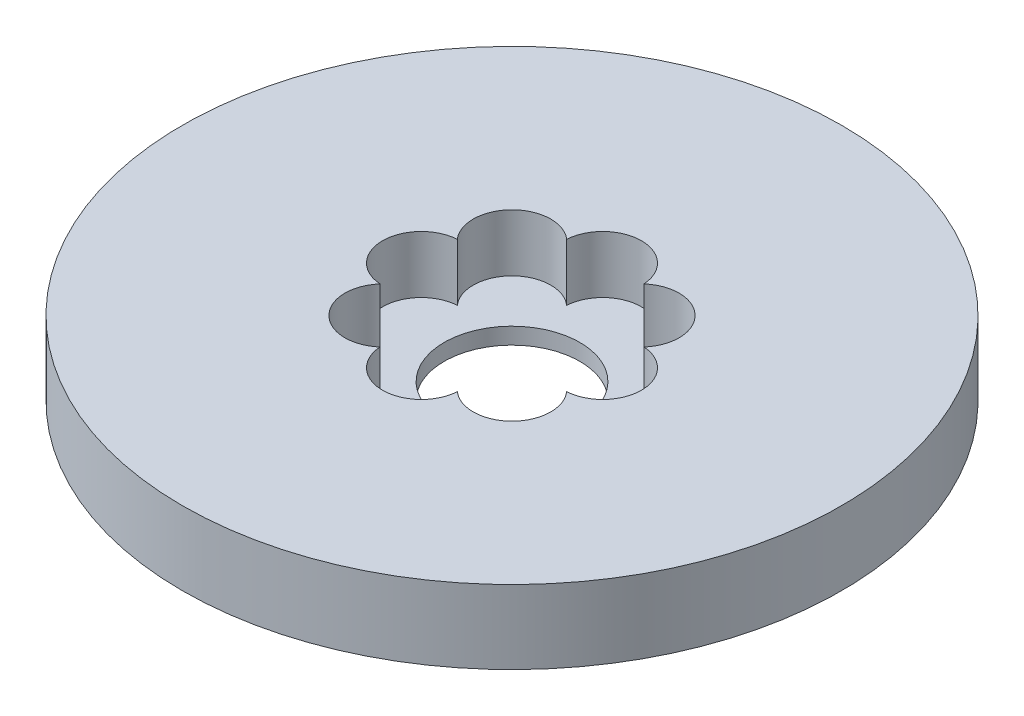
from build123d import *

# Parameters (mm, degrees)
SKETCH1_R           = 85
BOSS_EXTRUDE1_DEPTH = 19
SKETCH2_R           = 17.5
CUT_EXTRUDE1_DEPTH  = 122.70045193
SKETCH3_R           = 10
CUT_EXTRUDE2_DEPTH  = 14.761809073
CIRPATTERN1_COUNT   = 8


with BuildPart() as part:
    # Sketch1 → Boss-Extrude1 (new body)
    with BuildSketch(Plane(origin=(0, 0, 0), x_dir=(1, 0, 0), z_dir=(0, 1, 0))):
        Circle(SKETCH1_R)
    extrude(amount=BOSS_EXTRUDE1_DEPTH)

    # Sketch2 → Cut-Extrude1 (cut, through all)
    with BuildSketch(Plane(origin=(0, 0, 0), x_dir=(1, 0, 0), z_dir=(0, 1, 0))):
        Circle(SKETCH2_R)
    extrude(amount=CUT_EXTRUDE1_DEPTH, mode=Mode.SUBTRACT)

    # Sketch3 → Cut-Extrude2 (cut)
    with BuildSketch(Plane(origin=(0, 19, 0), x_dir=(1, 0, 0), z_dir=(0, 1, 0))):
        with Locations((-23.395464248, 0)):
            Circle(SKETCH3_R)
    cut_extrude2 = extrude(amount=-CUT_EXTRUDE2_DEPTH, mode=Mode.SUBTRACT)

    # CirPattern1: Cut-Extrude2 ×8 about axis
    cirpattern1_axis = Axis((0, 0, 0), (0, 1, 0))
    for i in range(1, CIRPATTERN1_COUNT):
        add(cut_extrude2.rotate(cirpattern1_axis, i * 360 / CIRPATTERN1_COUNT), mode=Mode.SUBTRACT)


solid = part.part
